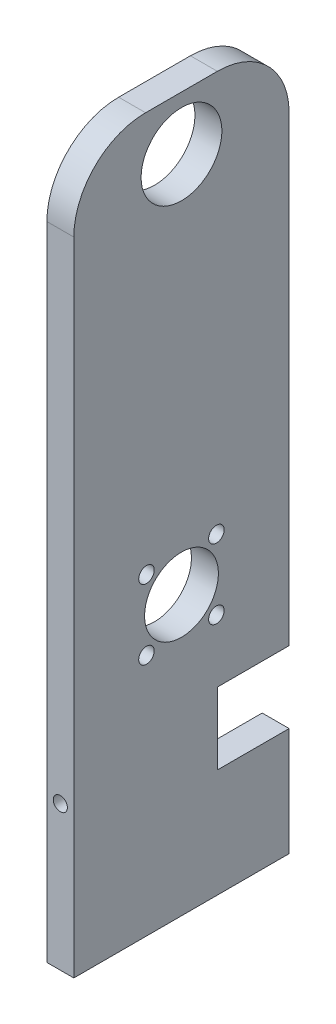
from build123d import *

# Parameters (mm, degrees)
SKETCH1_W                   = 9.525
SKETCH1_H                   = 76.2
BOSS_EXTRUDE1_DEPTH         = 126.238
SKETCH3_R                   = 14.2875
SKETCH3_R_2                 = 2.75
SKETCH3_R_3                 = 13.0556
CUT_EXTRUDE2_DEPTH          = 45.974
FILLET1_R                   = 25.4
SKETCH5_W                   = 25.4
SKETCH5_H                   = 25.4
CUT_EXTRUDE4_DEPTH          = 133.205780014
TAP_DRILL_FOR_M6X1_0_TAP1_D = 5


with BuildPart() as part:
    # Sketch1 → Boss-Extrude1 (new, symmetric)
    with BuildSketch(Plane(origin=(0, 0, 0), x_dir=(1, 0, 0), z_dir=(0, 1, 0))):
        Rectangle(SKETCH1_W, SKETCH1_H)
    extrude(amount=BOSS_EXTRUDE1_DEPTH, both=True)

    # Sketch3 → Cut-Extrude2 (cut)
    with BuildSketch(Plane.ZY.offset(4.7625)):
        with Locations((0, 107.188)):
            Circle(SKETCH3_R)
        with Locations((-12.365845519, -15.443650505)):
            Circle(SKETCH3_R_2)
        with Locations((12.374792935, -15.443650505)):
            Circle(SKETCH3_R_2)
        with Locations((-12.365845519, -40.187792935)):
            Circle(SKETCH3_R_2)
        with Locations((12.374792935, -40.187792935)):
            Circle(SKETCH3_R_2)
        with Locations((0, -27.813)):
            Circle(SKETCH3_R_3)
    extrude(amount=-CUT_EXTRUDE2_DEPTH, mode=Mode.SUBTRACT)

    # Fillet1
    fillet1_edges = [part.edges().sort_by_distance(p)[0] for p in [
        (0, 126.238, 38.1),
        (0, 126.238, -38.1),
    ]]
    fillet(fillet1_edges, radius=FILLET1_R)

    # Sketch5 → Cut-Extrude4 (cut, through all)
    with BuildSketch(Plane.ZY.offset(4.7625)):
        with Locations((-25.4, -75.184)):
            Rectangle(SKETCH5_W, SKETCH5_H)
    extrude(amount=-CUT_EXTRUDE4_DEPTH, mode=Mode.SUBTRACT)

    # Tap Drill for M6x1.0 Tap1 (through all)
    with Locations(Plane(origin=(0, 0, -12.7), x_dir=(-1, 0, 0), z_dir=(0, 0, -1))):
        with Locations((0, -75.184)):
            Hole(TAP_DRILL_FOR_M6X1_0_TAP1_D / 2)


solid = part.part
